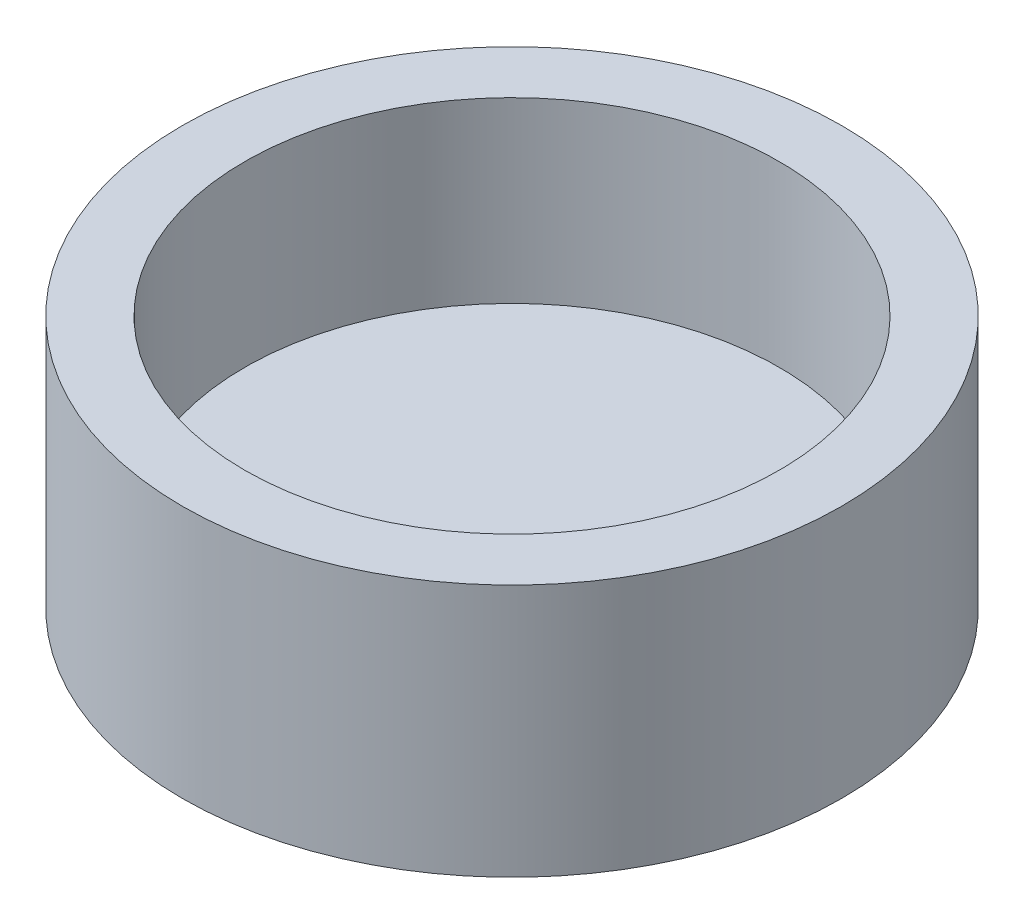
from build123d import *

# Parameters (mm, degrees)
SKETCH1_R           = 9.25
BOSS_EXTRUDE1_DEPTH = 7.1
SKETCH2_R           = 7.5
CUT_EXTRUDE1_DEPTH  = 5


with BuildPart() as part:
    # Sketch1 → Boss-Extrude1 (new body)
    with BuildSketch(Plane(origin=(0, 0, 0), x_dir=(1, 0, 0), z_dir=(0, 1, 0))):
        Circle(SKETCH1_R)
    extrude(amount=BOSS_EXTRUDE1_DEPTH)

    # Sketch2 → Cut-Extrude1 (cut)
    with BuildSketch(Plane(origin=(0, 7.1, 0), x_dir=(1, 0, 0), z_dir=(0, 1, 0))):
        Circle(SKETCH2_R)
    extrude(amount=-CUT_EXTRUDE1_DEPTH, mode=Mode.SUBTRACT)


solid = part.part
